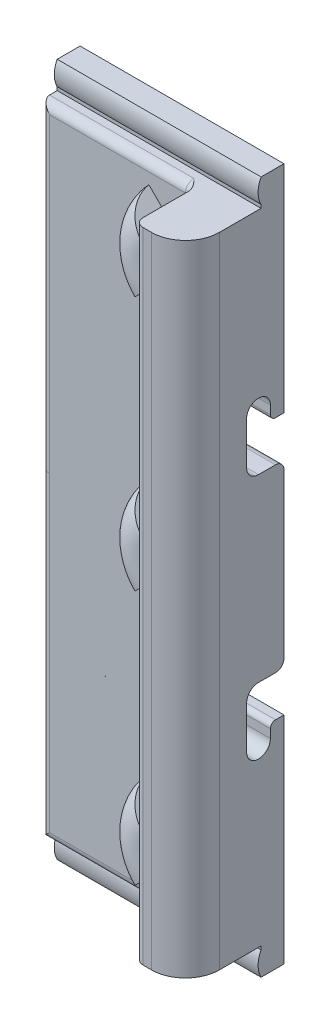
from build123d import *

# Parameters (mm, degrees)
BOSS_EXTRUDE1_DEPTH    = 3
BOSS_EXTRUDE2_START    = -9
BOSS_EXTRUDE2_DEPTH    = 9
FILLET1_R              = 0.5
FILLET1_OF_MIRROR1_R   = 0.5
REVOLVE1_ANGLE         = 90
FILLET2_R              = 0.5
LPATTERN1_COUNT        = 2
LPATTERN1_PITCH        = 15
LPATTERN1_COUNT_DIR2   = 2
LPATTERN1_PITCH_DIR2   = 15
FILLET2_OF_LPATTERN1_R = 0.5
FILLET3_R              = 2
FILLET4_R              = 0.5


# Read off the part's stored shape, not the designer's step: Revolve1
with BuildPart() as part:
    # Sketch1 → Boss-Extrude1 (new body)
    with BuildSketch(Plane(origin=(0.446999164, 0, 0), x_dir=(0, 0, -1), z_dir=(1, 0, 0))):
        with BuildLine():
            Line((-2.5, 7.7), (-2, 7.7))
            Line((-2, 7.7), (-2, 20.4))
            Line((-2, 20.4), (-3.35, 20.4))
            ThreePointArc((-3.35, 20.4), (-3.523350084, 19.7), (-3.35, 19))
            Line((-3.35, 19), (-3.35, 18.8))
            Line((-3.35, 18.8), (-7.8, 18.8))
            Line((-7.8, 18.8), (-7.8, 0))
            Line((-7.8, 0), (-2, 0))
            Line((-2, 0), (-2, 4.8))
            ThreePointArc((-2, 4.8), (-2.146446609, 5.153553391), (-2.5, 5.3))
            Line((-2.5, 5.3), (-3.5, 5.3))
            ThreePointArc((-3.5, 5.3), (-3.994974747, 5.505025253), (-4.2, 6))
            Line((-4.2, 6), (-4.2, 8.5))
            ThreePointArc((-4.2, 8.5), (-3.5, 9.2), (-2.8, 8.5))
            Line((-2.8, 8.5), (-2.8, 8))
            ThreePointArc((-2.8, 8), (-2.712132034, 7.787867966), (-2.5, 7.7))
        make_face()
    boss_extrude1 = extrude(amount=BOSS_EXTRUDE1_DEPTH)

    # Sketch1<3> → Boss-Extrude2 (add)
    with BuildSketch(Plane(origin=(0.446999164, 0, 0), x_dir=(0, 0, -1), z_dir=(1, 0, 0)).offset(BOSS_EXTRUDE2_START)):
        with BuildLine():
            Line((-2.5, 7.7), (-2, 7.7))
            Line((-2, 7.7), (-2, 20.4))
            Line((-2, 20.4), (-3.35, 20.4))
            ThreePointArc((-3.35, 20.4), (-3.523350084, 19.7), (-3.35, 19))
            Line((-3.35, 19), (-3.35, 18.8))
            Line((-3.35, 18.8), (-4.3, 18.8))
            Line((-4.3, 18.8), (-4.3, 0))
            Line((-4.3, 0), (-2, 0))
            Line((-2, 0), (-2, 4.8))
            ThreePointArc((-2, 4.8), (-2.146446609, 5.153553391), (-2.5, 5.3))
            Line((-2.5, 5.3), (-3.5, 5.3))
            ThreePointArc((-3.5, 5.3), (-3.994974747, 5.505025253), (-4.2, 6))
            Line((-4.2, 6), (-4.2, 8.5))
            ThreePointArc((-4.2, 8.5), (-3.5, 9.2), (-2.8, 8.5))
            Line((-2.8, 8.5), (-2.8, 8))
            ThreePointArc((-2.8, 8), (-2.712132034, 7.787867966), (-2.5, 7.7))
        make_face()
    boss_extrude2 = extrude(amount=BOSS_EXTRUDE2_DEPTH)

    # Fillet1
    # the kernel refuses this fillet: 0.5 mm, written as the material it takes off along each edge
    with BuildSketch(Plane(origin=(-8.553000836, 20.05, 4.3), x_dir=(0, 0, -1), z_dir=(0, -1, 0))) as fillet1_piece_1:
        with BuildLine():
            CenterArc((FILLET1_R, FILLET1_R), FILLET1_R, 180, 90)
            Line((0, FILLET1_R), (0, 0))
            Line((0, 0), (FILLET1_R, 0))
        make_face()
    extrude(amount=21.3, mode=Mode.SUBTRACT)
    with BuildSketch(Plane(origin=(-9.803000836, 18.8, 4.3), x_dir=(0, -1, 0), z_dir=(1, 0, 0))) as fillet1_piece_2:
        with BuildLine():
            CenterArc((FILLET1_R, FILLET1_R), FILLET1_R, 180, 90)
            Line((0, FILLET1_R), (0, 0))
            Line((0, 0), (FILLET1_R, 0))
        make_face()
    extrude(amount=10.25, mode=Mode.SUBTRACT)

    # Mirror1: Boss-Extrude1, Boss-Extrude2 across plane
    add(boss_extrude1.mirror(Plane.ZX))
    add(boss_extrude2.mirror(Plane.ZX))

    # Fillet1 of Mirror1
    # the kernel refuses this fillet: 0.5 mm, written as the material it takes off along each edge
    with BuildSketch(Plane(origin=(-8.553000836, -20.05, 4.3), x_dir=(1, 0, 0), z_dir=(0, 1, 0))) as fillet1_of_mirror1_piece_1:
        with BuildLine():
            CenterArc((FILLET1_OF_MIRROR1_R, FILLET1_OF_MIRROR1_R), FILLET1_OF_MIRROR1_R, 180, 90)
            Line((0, FILLET1_OF_MIRROR1_R), (0, 0))
            Line((0, 0), (FILLET1_OF_MIRROR1_R, 0))
        make_face()
    extrude(amount=21.3, mode=Mode.SUBTRACT)
    with BuildSketch(Plane(origin=(-9.803000836, -18.8, 4.3), x_dir=(0, 1, 0), z_dir=(1, 0, 0))) as fillet1_of_mirror1_piece_2:
        with BuildLine():
            CenterArc((FILLET1_OF_MIRROR1_R, -FILLET1_OF_MIRROR1_R), FILLET1_OF_MIRROR1_R, 90, 90)
            Line((0, -FILLET1_OF_MIRROR1_R), (0, 0))
            Line((0, 0), (FILLET1_OF_MIRROR1_R, 0))
        make_face()
    extrude(amount=10.25, mode=Mode.SUBTRACT)

    # Revolve1 outline → Revolve1 (revolve)
    with BuildSketch(Plane(origin=(0.446999164, 0, 0), x_dir=(-0.7071067811865444, 0.7071067811865507, 0), z_dir=(0.7071067811865507, 0.7071067811865444, 0))):
        with BuildLine():
            ThreePointArc((0.75, 5.8), (1.810660172, 5.360660172), (2.25, 4.3))
            Line((2.25, 4.3), (3.75, 4.3))
            ThreePointArc((3.75, 4.3), (2.657087474, 5.864174948), (0.75, 5.8))
        make_face()
    revolve1 = revolve(axis=Axis((0.446999164, 0, 0), (0, 0, 1)), revolution_arc=REVOLVE1_ANGLE)

    # Fillet2
    fillet2_edges = [part.edges().sort_by_distance(p)[0] for p in [
        (-0.833330922, -1.280330086, 5.360660172),
        (-0.833330922, 1.280330086, 5.360660172),
    ]]
    fillet(fillet2_edges, radius=FILLET2_R)

    # LPattern1: Revolve1 2 × 2, 1 skipped
    with Locations(*[Vector(0, 1, 0) * (i * LPATTERN1_PITCH) + Vector(0, -1, 0) * (j * LPATTERN1_PITCH_DIR2) for i in range(LPATTERN1_COUNT) for j in range(LPATTERN1_COUNT_DIR2) if (i, j) not in ((0, 0), (1, 1))]):
        add(revolve1)

    # Fillet2 of LPattern1
    fillet2_of_lpattern1_edges = [part.edges().sort_by_distance(p)[0] for p in [
        (-0.833330922, -16.280330086, 5.360660172),
        (-0.833330922, -13.719669914, 5.360660172),
        (-0.833330922, 13.719669914, 5.360660172),
        (-0.833330922, 16.280330086, 5.360660172),
    ]]
    fillet(fillet2_of_lpattern1_edges, radius=FILLET2_OF_LPATTERN1_R)

    # Fillet3
    fillet3_edges = [part.edges().sort_by_distance(p)[0] for p in [
        (3.446999164, 0, 7.8),
    ]]
    fillet(fillet3_edges, radius=FILLET3_R)

    # Fillet4
    fillet4_edges = [part.edges().sort_by_distance(p)[0] for p in [
        (0.446999164, 18.653553391, 4.153553391),
        (0.446999164, -18.653553391, 4.153553391),
        (0.446999164, 0, 7.8),
        (0.446999164, 0, 4.3),
    ]]
    fillet(fillet4_edges, radius=FILLET4_R)


solid = part.part
